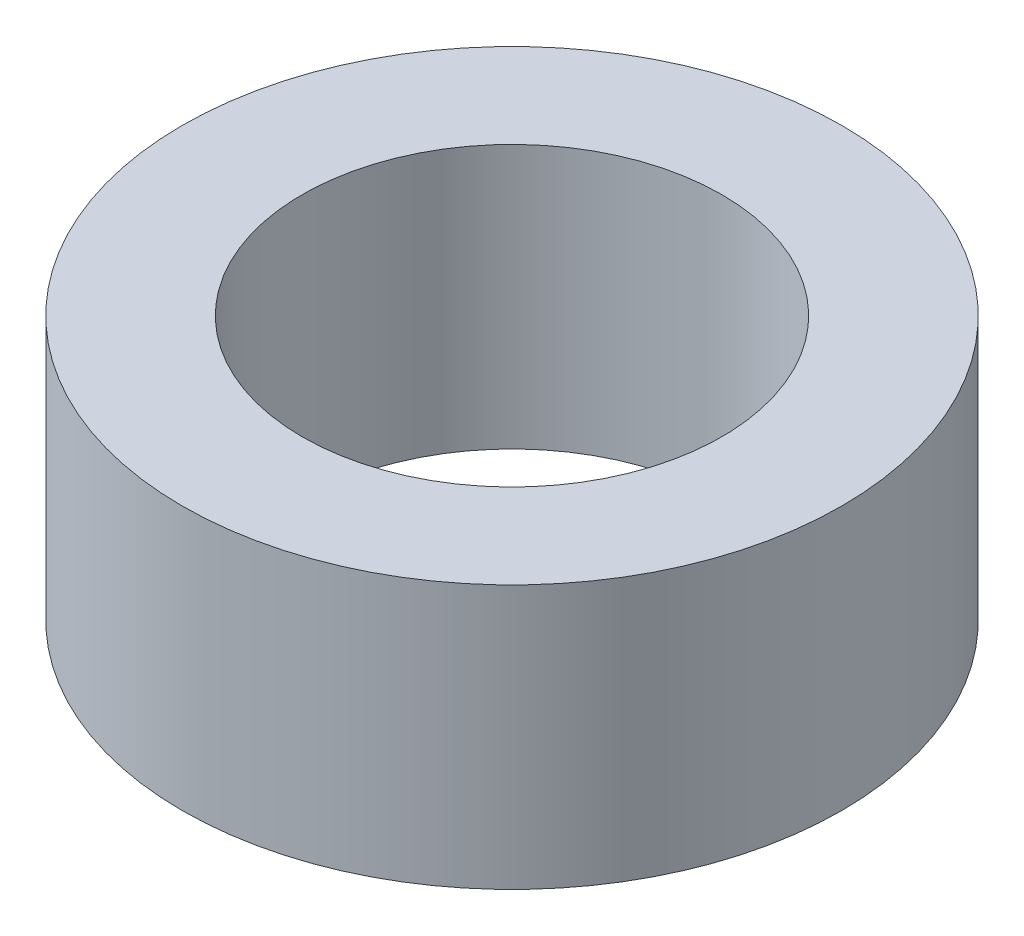
from build123d import *

# Parameters (mm, degrees)
SKETCH1_R           = 27.5
BOSS_EXTRUDE1_DEPTH = 22
SKETCH2_R           = 17.5
CUT_EXTRUDE1_DEPTH  = 45.682211225


with BuildPart() as part:
    # Sketch1 → Boss-Extrude1 (new body)
    with BuildSketch(Plane(origin=(0, 0, 0), x_dir=(1, 0, 0), z_dir=(0, 1, 0))):
        Circle(SKETCH1_R)
    extrude(amount=BOSS_EXTRUDE1_DEPTH)

    # Sketch2 → Cut-Extrude1 (cut, through all)
    with BuildSketch(Plane(origin=(0, 0, 0), x_dir=(1, 0, 0), z_dir=(0, 1, 0))):
        Circle(SKETCH2_R)
    extrude(amount=CUT_EXTRUDE1_DEPTH, mode=Mode.SUBTRACT)


solid = part.part
